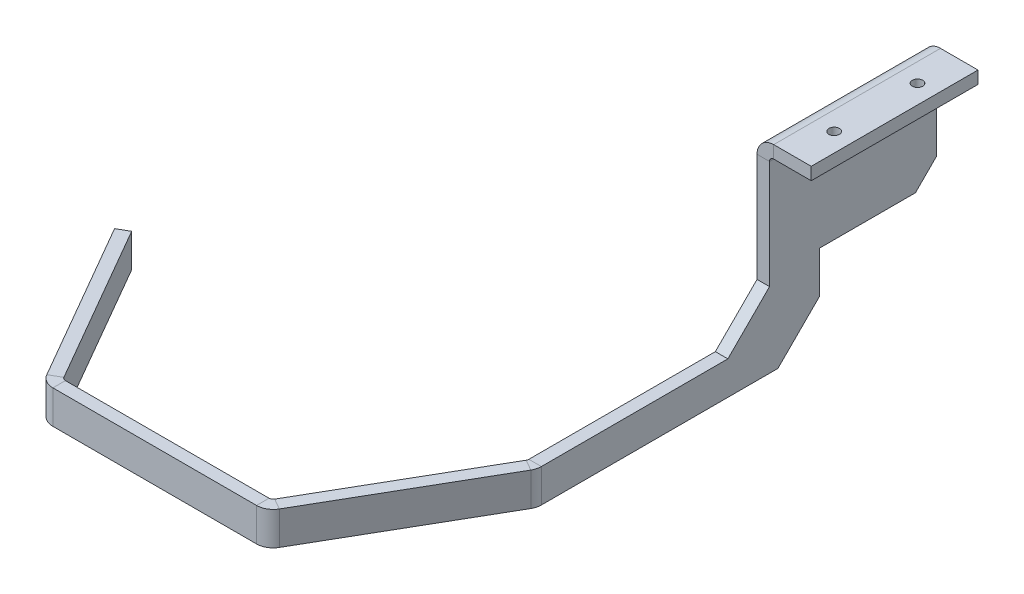
from build123d import *

# Parameters (mm, degrees)
SM_BASE_FLANGE_1_DEPTH           = 40
M3X0_5_1_D                       = 2.5
SKETCH_22_W                      = 3
SKETCH_22_H                      = 12
EXTRUDE_6_DEPTH                  = 12
SKETCH_23_W                      = 3
SKETCH_23_H                      = 67
EXTRUDE_7_DEPTH                  = 8
CHAMFER_1_SIZE                   = 10
CHAMFER_2_SIZE                   = 5
SM_EDGE_FLANGE_1_STRIP_CUT_DEPTH = 8
SM_EDGE_FLANGE_1_DEPTH           = 8
SM_EDGE_FLANGE_2_STRIP_CUT_DEPTH = 8
SM_EDGE_FLANGE_2_DEPTH           = 8
SM_EDGE_FLANGE_3_STRIP_CUT_DEPTH = 8
SM_EDGE_FLANGE_3_DEPTH           = 8


# Sheet-metal steps are written as plain solids
with BuildPart() as part:
    # 草圖3 → 基材-凸緣1 (new body)
    with BuildSketch(Plane.XY):
        with BuildLine():
            Line((10, 0), (1, 0))
            ThreePointArc((1, 0), (0.292893219, -0.292893219), (0, -1))
            Line((0, -1), (0, -25))
            Line((0, -25), (-3, -25))
            Line((-3, -25), (-3, -1))
            ThreePointArc((-3, -1), (-1.828427125, 1.828427125), (1, 3))
            Line((1, 3), (10, 3))
            Line((10, 3), (10, 0))
        make_face()
    extrude(amount=SM_BASE_FLANGE_1_DEPTH)

    # M3x0.5 螺紋孔1 (through all)
    with Locations(Plane(origin=(0, 3, 0), x_dir=(1, 0, 0), z_dir=(0, 1, 0))):
        with Locations((5.5, -30), (5.5, -10)):
            Hole(M3X0_5_1_D / 2)

    # 草圖22 → 填料-伸長6 (add)
    with BuildSketch(Plane.XZ.offset(25)):
        with Locations((-1.5, 34)):
            Rectangle(SKETCH_22_W, SKETCH_22_H)
    extrude(amount=EXTRUDE_6_DEPTH)

    # 草圖23 → 填料-伸長7 (add)
    with BuildSketch(Plane.XZ.offset(37)):
        with Locations((-1.5, 61.5)):
            Rectangle(SKETCH_23_W, SKETCH_23_H)
    extrude(amount=EXTRUDE_7_DEPTH)

    # 導角1
    chamfer_1_edges = [part.edges().sort_by_distance(p)[0] for p in [
        (-1.5, -37, 40),
        (-1.5, -45, 28),
    ]]
    chamfer(chamfer_1_edges, length=CHAMFER_1_SIZE)

    # 導角2
    chamfer_2_edges = [part.edges().sort_by_distance(p)[0] for p in [
        (-1.5, -25, 0),
    ]]
    chamfer(chamfer_2_edges, length=CHAMFER_2_SIZE)

    # 邊線-凸緣1 strip (across the edge) → 邊線-凸緣1 strip cut (cut)
    with BuildSketch(Plane(origin=(-3, -45, 95), x_dir=(-0.8660254037844416, 0, -0.49999999999999495), z_dir=(0, 1, 0))):
        Polygon((-9.464101615, 10.392304845), (-2.464101615, -1.732050808), (0.133974596, -0.232050808), (-6.866025404, 11.892304845), align=None)
    extrude(amount=SM_EDGE_FLANGE_1_STRIP_CUT_DEPTH, mode=Mode.SUBTRACT)

    # 邊線-凸緣1 section (across the edge) → 邊線-凸緣1 (add)
    with BuildSketch(Plane(origin=(-3, -45, 95), x_dir=(-0.8660254037844416, 0, -0.49999999999999495), z_dir=(0, 1, 0))):
        with BuildLine():
            Line((-3, 0.267949192), (-3, 45))
            Line((-3, 45), (0, 45))
            Line((0, 45), (0, 0.267949192))
            ThreePointArc((0, 0.267949192), (0.034074174, 0.009130147), (0.133974596, -0.232050808))
            Line((0.133974596, -0.232050808), (-2.464101615, -1.732050808))
            ThreePointArc((-2.464101615, -1.732050808), (-2.863703305, -0.767326988), (-3, 0.267949192))
        make_face()
    extrude(amount=SM_EDGE_FLANGE_1_DEPTH)

    # 邊線-凸緣2 strip (across the edge) → 邊線-凸緣2 strip cut (cut)
    with BuildSketch(Plane(origin=(-25.5, -45, 133.97114317), x_dir=(0, 0, -1), z_dir=(0, 1, 0))):
        Polygon((-13.124355653, 4.113248654), (-1, -2.886751346), (0.5, -0.288675135), (-11.624355653, 6.711324865), align=None)
    extrude(amount=SM_EDGE_FLANGE_2_STRIP_CUT_DEPTH, mode=Mode.SUBTRACT)

    # 邊線-凸緣2 section (across the edge) → 邊線-凸緣2 (add)
    with BuildSketch(Plane(origin=(-25.5, -45, 133.97114317), x_dir=(0, 0, -1), z_dir=(0, 1, 0))):
        with BuildLine():
            Line((-3, 0.577350269), (-3, 50))
            Line((-3, 50), (0, 50))
            Line((0, 50), (0, 0.577350269))
            ThreePointArc((0, 0.577350269), (0.133974596, 0.077350269), (0.5, -0.288675135))
            Line((0.5, -0.288675135), (-1, -2.886751346))
            ThreePointArc((-1, -2.886751346), (-2.464101615, -1.422649731), (-3, 0.577350269))
        make_face()
    extrude(amount=SM_EDGE_FLANGE_2_DEPTH)

    # 邊線-凸緣3 strip (across the edge) → 邊線-凸緣3 strip cut (cut)
    with BuildSketch(Plane(origin=(-75.5, -45, 133.97114317), x_dir=(0.8660254037844312, 0, -0.5000000000000132), z_dir=(0, 1, 0))):
        Polygon((-13.124355653, 4.113248654), (-1, -2.886751346), (0.5, -0.288675135), (-11.624355653, 6.711324865), align=None)
    extrude(amount=SM_EDGE_FLANGE_3_STRIP_CUT_DEPTH, mode=Mode.SUBTRACT)

    # 邊線-凸緣3 section (across the edge) → 邊線-凸緣3 (add)
    with BuildSketch(Plane(origin=(-75.5, -45, 133.97114317), x_dir=(0.8660254037844312, 0, -0.5000000000000132), z_dir=(0, 1, 0))):
        with BuildLine():
            Line((-3, 0.577350269), (-3, 45))
            Line((-3, 45), (0, 45))
            Line((0, 45), (0, 0.577350269))
            ThreePointArc((0, 0.577350269), (0.133974596, 0.077350269), (0.5, -0.288675135))
            Line((0.5, -0.288675135), (-1, -2.886751346))
            ThreePointArc((-1, -2.886751346), (-2.464101615, -1.422649731), (-3, 0.577350269))
        make_face()
    extrude(amount=SM_EDGE_FLANGE_3_DEPTH)


solid = part.part
